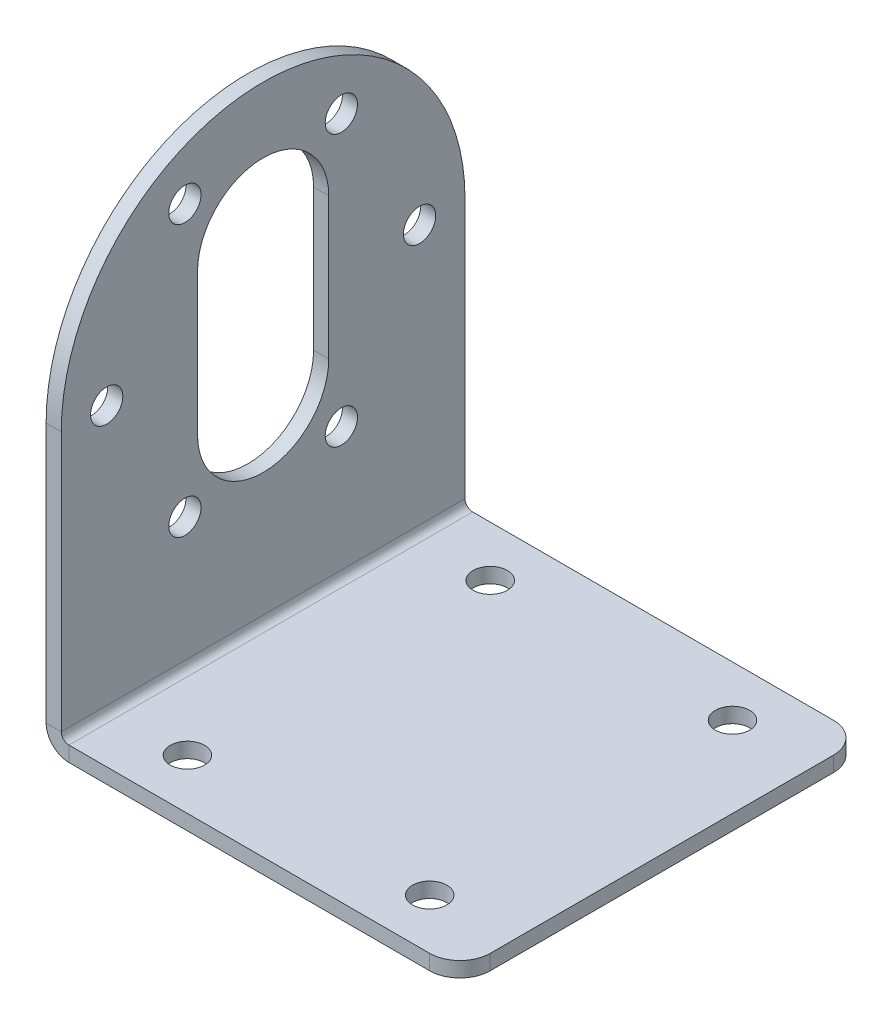
from build123d import *

# Parameters (mm, degrees)
BOSS_EXTRUDE1_DEPTH    = 1.5
SKETCH2_W              = 41
SKETCH2_H              = 40
BOSS_EXTRUDE2_DEPTH    = 1.5
CONVERT_SOLID1_START   = -20
CONVERT_SOLID1_DEPTH   = 40
CONVERT_SOLID1_2_DEPTH = 40
M3_CLEARANCE_HOLE1_D   = 3.2
CIRPATTERN1_COUNT      = 6
CUT_EXTRUDE1_DEPTH     = 54.525694764
M3_CLEARANCE_HOLE2_D   = 3.4
LPATTERN1_COUNT        = 2
LPATTERN1_PITCH        = 24
LPATTERN1_COPY_1_D     = 3.4
FILLET1_R              = 3


# Read off the part's stored shape, not the designer's step: Convert-Solid1
with BuildPart() as part:
    # Sketch1 → Boss-Extrude1 (new body)
    with BuildSketch(Plane(origin=(0, 0, 0), x_dir=(0, 0, -1), z_dir=(1, 0, 0))):
        with BuildLine():
            Line((-20, 0), (-20, -28))
            Line((-20, -28), (20, -28))
            Line((20, -28), (20, 0))
            ThreePointArc((20, 0), (0, 20), (-20, 0))
        make_face()
    extrude(amount=BOSS_EXTRUDE1_DEPTH)

    # Sketch2 → Boss-Extrude2 (add)
    with BuildSketch(Plane.XZ.offset(28)):
        with Locations((20.5, 0)):
            Rectangle(SKETCH2_W, SKETCH2_H)
    extrude(amount=-BOSS_EXTRUDE2_DEPTH)

    # Convert-Solid1 outline → Convert-Solid1 (cut)
    with BuildSketch(Plane.XY.offset(CONVERT_SOLID1_START)):
        with BuildLine():
            Line((0, -28), (2.262, -28))
            ThreePointArc((2.262, -28), (0.662524461, -27.337475539), (0, -25.738))
            Line((0, -25.738), (0, -28))
        make_face()
    extrude(amount=CONVERT_SOLID1_DEPTH, mode=Mode.SUBTRACT)

    # Convert-Solid1 2 outline → Convert-Solid1 2 (add)
    with BuildSketch(Plane.XY.offset(CONVERT_SOLID1_START)):
        with BuildLine():
            Line((1.5, -26.5), (2.262, -26.5))
            ThreePointArc((2.262, -26.5), (1.723184633, -26.276815367), (1.5, -25.738))
            Line((1.5, -25.738), (1.5, -26.5))
        make_face()
    extrude(amount=CONVERT_SOLID1_2_DEPTH)

    # M3 Clearance Hole1 (through all)
    with Locations(Plane.ZY):
        with Locations((-15.5, 0)):
            m3_clearance_hole1 = Hole(M3_CLEARANCE_HOLE1_D / 2)

    # CirPattern1: M3 Clearance Hole1 ×6 about axis
    cirpattern1_axis = Axis((0, 0, 0), (1, 0, 0))
    for i in range(1, CIRPATTERN1_COUNT):
        add(m3_clearance_hole1.rotate(cirpattern1_axis, i * 360 / CIRPATTERN1_COUNT), mode=Mode.SUBTRACT)

    # Sketch9 → Cut-Extrude1 (cut, through all)
    with BuildSketch(Plane.ZY):
        with BuildLine():
            Line((6.5, 7), (6.5, -7))
            ThreePointArc((6.5, -7), (0, -13.5), (-6.5, -7))
            Line((-6.5, -7), (-6.5, 7))
            ThreePointArc((-6.5, 7), (0, 13.5), (6.5, 7))
        make_face()
    extrude(amount=-CUT_EXTRUDE1_DEPTH, mode=Mode.SUBTRACT)

    # M3 Clearance Hole2 (through all)
    with Locations(Plane(origin=(0, -26.5, 0), x_dir=(1, 0, 0), z_dir=(0, 1, 0))):
        with Locations((33, 15)):
            m3_clearance_hole2 = Hole(M3_CLEARANCE_HOLE2_D / 2)

    # Mirror1: M3 Clearance Hole2 across plane
    add(m3_clearance_hole2.mirror(Plane.XY), mode=Mode.SUBTRACT)

    # LPattern1: M3 Clearance Hole2 ×2
    with Locations(*[(-i * LPATTERN1_PITCH, 0, 0) for i in range(1, LPATTERN1_COUNT)]):
        add(m3_clearance_hole2, mode=Mode.SUBTRACT)

    # LPattern1 copy 1 (through all)
    with Locations(Plane(origin=(-24, -26.5, 0), x_dir=(1, 0, 0), z_dir=(0, 1, 0))):
        with Locations((33, -15)):
            Hole(LPATTERN1_COPY_1_D / 2)

    # Fillet1
    fillet1_edges = [part.edges().sort_by_distance(p)[0] for p in [
        (41, -27.25, 20),
        (41, -27.25, -20),
    ]]
    fillet(fillet1_edges, radius=FILLET1_R)


solid = part.part
